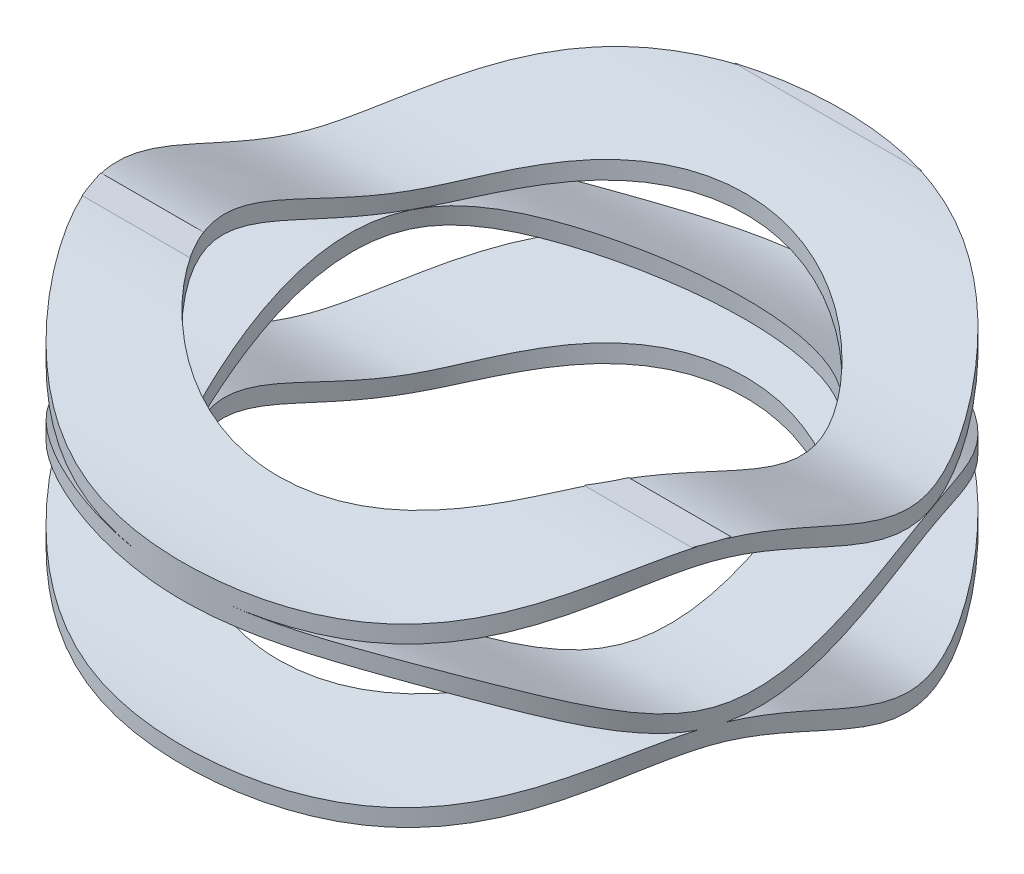
from build123d import *

# Parameters (mm, degrees)
EXTRUDE_THIN1_START     = -9
EXTRUDE_THIN1_DEPTH     = 18
BOSS_EXTRUDE2_DEPTH     = 9
LPATTERN3_COUNT         = 2
LPATTERN3_PITCH         = 2.893333
SKETCH11_W              = 6.51
SKETCH11_H              = 6.51
BOSS_EXTRUDE1_DEPTH     = 0.254
CUT_EXTRUDE1_DEPTH      = 17.722144
CUT_EXTRUDE1_DEPTH_BACK = 17.722144
SKETCH8_OUTSIDE_W       = 24.628
SKETCH8_OUTSIDE_H       = 19.628
SKETCH8_OUTSIDE_R       = 6
SKETCH8_OUTSIDE_R_2     = 4.25
CUT_EXTRUDE2_DEPTH      = 15.611234
CUT_EXTRUDE2_DEPTH_BACK = 15.611234
SKETCH12_W              = 12.6
SKETCH12_H              = 1.519


# Read off the part's stored shape, not the designer's step: Extrude-Thin1
with BuildPart() as part:
    # Extrude-Thin1 outline → Extrude-Thin1 (new body)
    with BuildSketch(Plane(origin=(0, 0, 0), x_dir=(0, 0, -1), z_dir=(1, 0, 0)).offset(EXTRUDE_THIN1_START)):
        with BuildLine():
            Line((12, 1.148167), (12.5, 1.148167))
            Line((12.5, 1.148167), (12.5, 1.448167))
            Line((12.5, 1.448167), (12, 1.448167))
            add(Edge.make_bspline(
                [(0, 0.3), (0.031259, 0.299956), (0.058529, 0.300503), (0.117194, 0.302735), (0.205346, 0.307786), (0.293989, 0.317738), (0.471961, 0.3436), (0.591531, 0.368794), (0.952833, 0.463387), (1.197103, 0.551872), (1.937432, 0.850792), (2.439977, 1.095045), (3.210808, 1.344337), (3.47096, 1.407837), (3.866832, 1.447838), (4.000212, 1.451587), (4.26529, 1.437721), (4.39696, 1.420788), (5.05066, 1.297388), (5.559159, 1.076456), (6.559082, 0.645926), (7.050563, 0.436283), (7.76625, 0.301779), (7.998911, 0.288332), (8.47122, 0.33596), (8.711113, 0.393592), (9.440365, 0.628764), (9.937826, 0.86891), (10.697434, 1.175414), (10.953127, 1.268542), (11.341735, 1.370683), (11.472128, 1.398452), (11.669096, 1.427444), (11.734979, 1.434996), (11.834132, 1.442734), (11.867237, 1.444715), (11.93355, 1.447409), (11.968757, 1.448122), (12, 1.448167)],
                knots=[0, 0, 0, 0, 0.007812, 0.007812, 0.015625, 0.03125, 0.03125, 0.0625, 0.0625, 0.125, 0.125, 0.25, 0.25, 0.3125, 0.3125, 0.34375, 0.34375, 0.375, 0.375, 0.5, 0.5, 0.625, 0.625, 0.6875, 0.6875, 0.75, 0.75, 0.875, 0.875, 0.9375, 0.9375, 0.96875, 0.96875, 0.984375, 0.984375, 0.992188, 0.992188, 1, 1, 1, 1], degree=3))
            Line((0, 0.3), (-0.5, 0.3))
            Line((-0.5, 0.3), (-0.5, 0))
            Line((-0.5, 0), (0, 0))
            add(Edge.make_bspline(
                [(0, 0), (0.5325, -0.000712), (1.050041, 0.168945), (2.06298, 0.577969), (2.560369, 0.818703), (3.289375, 1.054437), (3.529157, 1.112203), (4.001189, 1.159874), (4.233688, 1.146318), (4.949045, 1.011257), (5.440429, 0.800951), (6.440506, 0.370355), (6.949141, 0.150112), (7.733655, 0.002643), (8.001066, -0.012955), (8.528895, 0.040237), (8.789068, 0.10353), (9.559979, 0.352098), (10.062585, 0.595731), (11.049731, 0.994083), (11.532331, 1.147455), (12, 1.148167)],
                knots=[0, 0, 0, 0, 0.125, 0.125, 0.25, 0.25, 0.3125, 0.3125, 0.375, 0.375, 0.5, 0.5, 0.625, 0.625, 0.6875, 0.6875, 0.75, 0.75, 0.875, 0.875, 1, 1, 1, 1], degree=3))
        make_face()
    extrude(amount=EXTRUDE_THIN1_DEPTH)

    # Sketch10 → Boss-Extrude2 (add, symmetric)
    with BuildSketch(Plane(origin=(0, 0, 0), x_dir=(0, 0, -1), z_dir=(1, 0, 0))):
        with BuildLine():
            Line((0.001061, 2.593333), (-0.5, 2.593333))
            Line((-0.5, 2.593333), (-0.5, 2.893333))
            Line((-0.5, 2.893333), (-0.001044, 2.893333))
            add(Edge.make_bspline(
                [(-0.001044, 2.893333), (0.533637, 2.900654), (1.570281, 2.559604), (2.812863, 1.946499), (3.769576, 1.706999), (4.698173, 1.762611), (5.930643, 2.303822), (7.200025, 2.859007), (8.268184, 2.919372), (9.310487, 2.661372), (10.313913, 2.176038), (11.29621, 1.816074), (11.761197, 1.735199), (12.001086, 1.731667)],
                knots=[8.4e-05, 8.4e-05, 8.4e-05, 8.4e-05, 0.125062, 0.25004, 0.312528, 0.375017, 0.499995, 0.624973, 0.687462, 0.749951, 0.874928, 0.937417, 0.999906, 0.999906, 0.999906, 0.999906], degree=3))
            Line((12.001086, 1.731667), (12.5, 1.731667))
            Line((12.5, 1.731667), (12.5, 1.431667))
            Line((12.5, 1.431667), (11.998931, 1.431667))
            add(Edge.make_bspline(
                [(0.001061, 2.593333), (0.240384, 2.596718), (0.706674, 2.524755), (1.687952, 2.167686), (2.690051, 1.670411), (3.731143, 1.404144), (4.799497, 1.4691), (6.064113, 2.041319), (7.297691, 2.564993), (8.232431, 2.616677), (9.192953, 2.383017), (10.438676, 1.784616), (11.465657, 1.439265), (11.998931, 1.431667)],
                knots=[-8.8e-05, -8.8e-05, -8.8e-05, -8.8e-05, 0.062423, 0.124934, 0.249956, 0.312467, 0.374978, 0.500001, 0.625023, 0.687534, 0.750045, 0.875067, 1.000089, 1.000089, 1.000089, 1.000089], degree=3))
        make_face()
    extrude(amount=BOSS_EXTRUDE2_DEPTH, both=True)


with BuildPart() as lpattern3_1:
    # LPattern3: pattern copy
    add(part.part.moved(Location(Vector(0, 1, 0) * (1 * LPATTERN3_PITCH))))


with BuildPart() as part_1:
    add(part.part)

    add(lpattern3_1.part)  # Boss-Extrude1 merges LPattern3_1
    # Sketch11 → Boss-Extrude1 (add)
    with BuildSketch(Plane.XY.offset(0.5)):
        with Locations((0, 3.255)):
            Rectangle(SKETCH11_W, SKETCH11_H)
    extrude(amount=-BOSS_EXTRUDE1_DEPTH)

    # Sketch8 outside → Cut-Extrude1 (cut, two sides: drawn at the far end of the back side and taken through both)
    # profile 1 of 2: a face of its own
    with BuildSketch(Plane(origin=(0, 0, 0), x_dir=(1, 0, 0), z_dir=(0, 1, 0)).offset(-CUT_EXTRUDE1_DEPTH_BACK)):
        with Locations((0, 6)):
            Rectangle(SKETCH8_OUTSIDE_W, SKETCH8_OUTSIDE_H)
        with Locations(Location((0, 6, 0), (0, 0, 270))):
            Circle(SKETCH8_OUTSIDE_R, mode=Mode.SUBTRACT)
    # profile 2 of 2: a face of its own
    with BuildSketch(Plane(origin=(0, 0, 0), x_dir=(1, 0, 0), z_dir=(0, 1, 0)).offset(-CUT_EXTRUDE1_DEPTH_BACK)):
        with Locations(Location((0, 6, 0), (0, 0, 270))):
            Circle(SKETCH8_OUTSIDE_R_2)
    extrude(amount=CUT_EXTRUDE1_DEPTH + CUT_EXTRUDE1_DEPTH_BACK, mode=Mode.SUBTRACT)

    # Sketch12 → Cut-Extrude2 (cut, two sides: drawn at the far end of the back side and taken through both)
    with BuildSketch(Plane(origin=(0, 0, 0), x_dir=(0, 0, -1), z_dir=(1, 0, 0)).offset(-CUT_EXTRUDE2_DEPTH_BACK)):
        with Locations((6, 5.0995)):
            Rectangle(SKETCH12_W, SKETCH12_H)
    extrude(amount=CUT_EXTRUDE2_DEPTH + CUT_EXTRUDE2_DEPTH_BACK, mode=Mode.SUBTRACT)


solid = part_1.part
